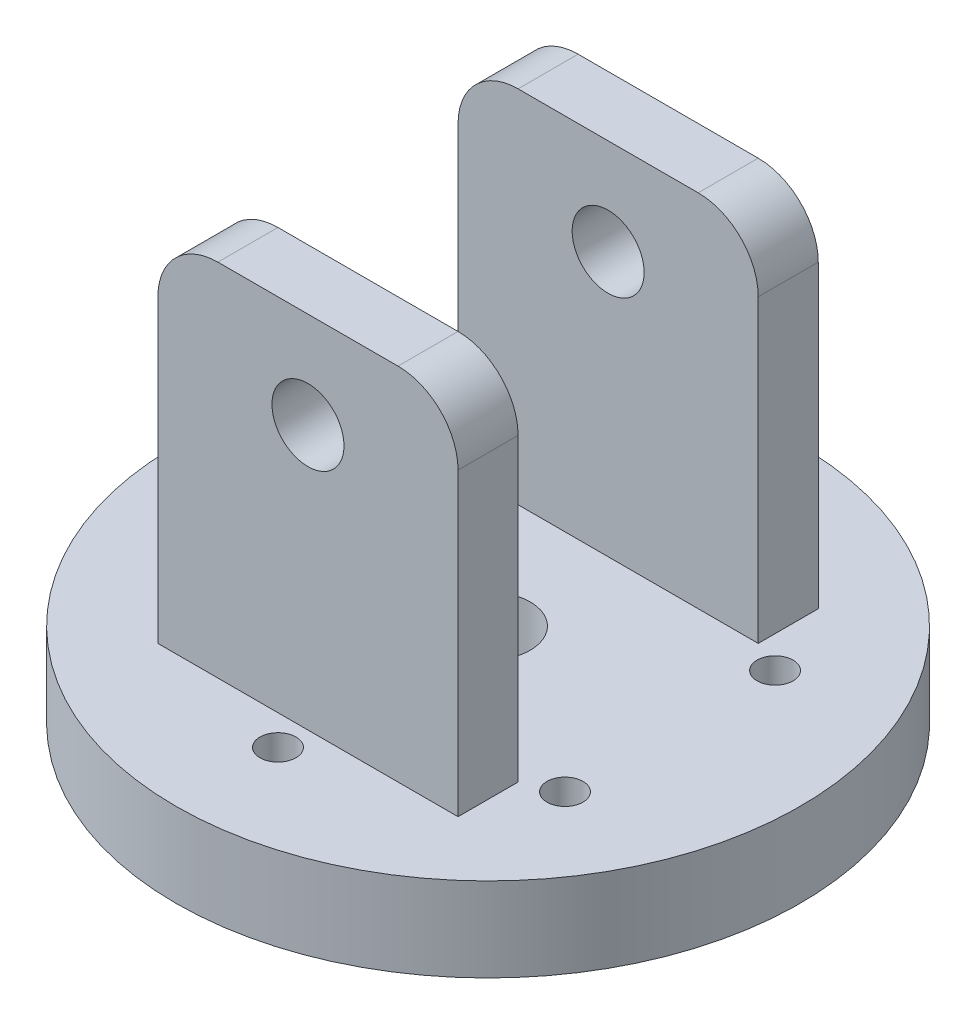
from build123d import *

# Parameters (mm, degrees)
ESQUISSE1_R                        = 52
ESQUISSE1_R_2                      = 7
BOSS_EXTRU_1_DEPTH                 = 14
ESQUISSE2_W                        = 50
ESQUISSE2_H                        = 10
BOSS_EXTRU_2_DEPTH                 = 60
CONG_1_R                           = 10
ESQUISSE3_R                        = 6
ENL_V_MAT_EXTRU_1_DEPTH            = 40
R_P_TITION_CIRCULAIRE1_COUNT       = 2
CONG_1_OF_R_P_TITION_CIRCULAIRE1_R = 10
ESQUISSE5_R                        = 2.5
ENL_V_MAT_EXTRU_2_DEPTH            = 20
R_P_TITION_CIRCULAIRE2_COUNT       = 6
ESQUISSE6_R                        = 3
ENL_V_MAT_EXTRU_3_DEPTH            = 11


with BuildPart() as part:
    # Esquisse1 → Boss.-Extru.1 (new body)
    with BuildSketch(Plane(origin=(0, 0, 0), x_dir=(1, 0, 0), z_dir=(0, 1, 0))):
        Circle(ESQUISSE1_R)
        Circle(ESQUISSE1_R_2, mode=Mode.SUBTRACT)
    extrude(amount=BOSS_EXTRU_1_DEPTH)

    # Esquisse2 → Boss.-Extru.2 (add)
    with BuildSketch(Plane(origin=(0, 14, 0), x_dir=(1, 0, 0), z_dir=(0, 1, 0))):
        with Locations((0, 25)):
            Rectangle(ESQUISSE2_W, ESQUISSE2_H)
    boss_extru_2 = extrude(amount=BOSS_EXTRU_2_DEPTH)

    # Congé1
    cong_1_edges = [part.edges().sort_by_distance(p)[0] for p in [
        (25, 74, -25),
        (-25, 74, -25),
    ]]
    fillet(cong_1_edges, radius=CONG_1_R)

    # Esquisse3 → Enlèv. mat.-Extru.1 (cut)
    with BuildSketch(Plane(origin=(0, 0, -30), x_dir=(-1, 0, 0), z_dir=(0, 0, -1))):
        with Locations((0, 58)):
            Circle(ESQUISSE3_R)
    enl_v_mat_extru_1 = extrude(amount=-ENL_V_MAT_EXTRU_1_DEPTH, mode=Mode.SUBTRACT)

    # Répétition circulaire1: Boss.-Extru.2, Enlèv. mat.-Extru.1 ×2 about axis
    r_p_tition_circulaire1_axis = Axis((0, 14, 0), (0, 1, 0))
    add([boss_extru_2.rotate(r_p_tition_circulaire1_axis, i * 360 / R_P_TITION_CIRCULAIRE1_COUNT) for i in range(1, R_P_TITION_CIRCULAIRE1_COUNT)])
    add([enl_v_mat_extru_1.rotate(r_p_tition_circulaire1_axis, i * 360 / R_P_TITION_CIRCULAIRE1_COUNT) for i in range(1, R_P_TITION_CIRCULAIRE1_COUNT)], mode=Mode.SUBTRACT)

    # Congé1 of Répétition circulaire1
    cong_1_of_r_p_tition_circulaire1_edges = [part.edges().sort_by_distance(p)[0] for p in [
        (-25, 74, 25),
        (25, 74, 25),
    ]]
    fillet(cong_1_of_r_p_tition_circulaire1_edges, radius=CONG_1_OF_R_P_TITION_CIRCULAIRE1_R)

    # Esquisse5 → Enlèv. mat.-Extru.2 (cut)
    with BuildSketch(Plane.XZ):
        with Locations((0, 35)):
            Circle(ESQUISSE5_R)
    enl_v_mat_extru_2 = extrude(amount=-ENL_V_MAT_EXTRU_2_DEPTH, mode=Mode.SUBTRACT)

    # Répétition circulaire2: Enlèv. mat.-Extru.2 ×6 about axis
    r_p_tition_circulaire2_axis = Axis((0, 0, 0), (0, 1, 0))
    for i in range(1, R_P_TITION_CIRCULAIRE2_COUNT):
        add(enl_v_mat_extru_2.rotate(r_p_tition_circulaire2_axis, i * 360 / R_P_TITION_CIRCULAIRE2_COUNT), mode=Mode.SUBTRACT)

    # Esquisse6 → Enlèv. mat.-Extru.3 (cut)
    with BuildSketch(Plane(origin=(0, 14, 0), x_dir=(1, 0, 0), z_dir=(0, 1, 0))):
        with Locations((30.310889132, 17.5)):
            Circle(ESQUISSE6_R)
        with Locations((30.310889132, -17.5)):
            Circle(ESQUISSE6_R)
        with Locations((0, -35)):
            Circle(ESQUISSE6_R)
        with Locations((-30.310889132, -17.5)):
            Circle(ESQUISSE6_R)
        with Locations((-30.310889132, 17.5)):
            Circle(ESQUISSE6_R)
        with Locations((0, 35)):
            Circle(ESQUISSE6_R)
    extrude(amount=-ENL_V_MAT_EXTRU_3_DEPTH, mode=Mode.SUBTRACT)


solid = part.part
